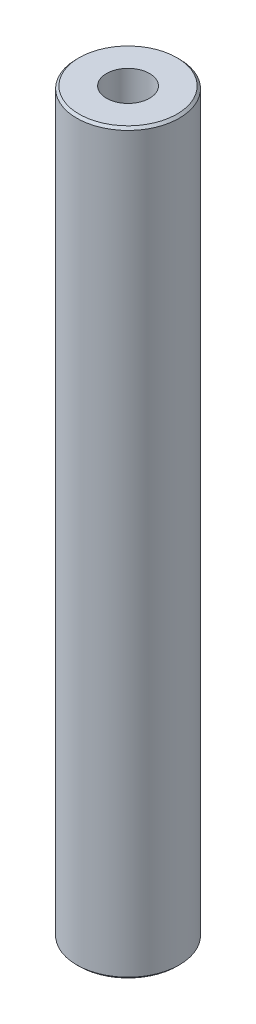
from build123d import *

# Parameters (mm, degrees)
SKETCH1_R           = 25
BOSS_EXTRUDE1_DEPTH = 359.907576155
SKETCH2_R           = 10.497307303
CUT_EXTRUDE1_DEPTH  = 362.63996374
CHAMFER1_SIZE       = 1.147252373


with BuildPart() as part:
    # Sketch1 → Boss-Extrude1 (new body)
    with BuildSketch(Plane(origin=(0, 0, 0), x_dir=(1, 0, 0), z_dir=(0, 1, 0))):
        Circle(SKETCH1_R)
    extrude(amount=BOSS_EXTRUDE1_DEPTH)

    # Sketch2 → Cut-Extrude1 (cut, through all)
    with BuildSketch(Plane(origin=(0, 0, 0), x_dir=(1, 0, 0), z_dir=(0, 1, 0))):
        Circle(SKETCH2_R)
    extrude(amount=CUT_EXTRUDE1_DEPTH, mode=Mode.SUBTRACT)

    # Chamfer1
    chamfer1_edges = [part.edges().sort_by_distance(p)[0] for p in [
        (-25, 359.907576155, 0),
        (-25, 0, 0),
    ]]
    chamfer(chamfer1_edges, length=CHAMFER1_SIZE)


solid = part.part
